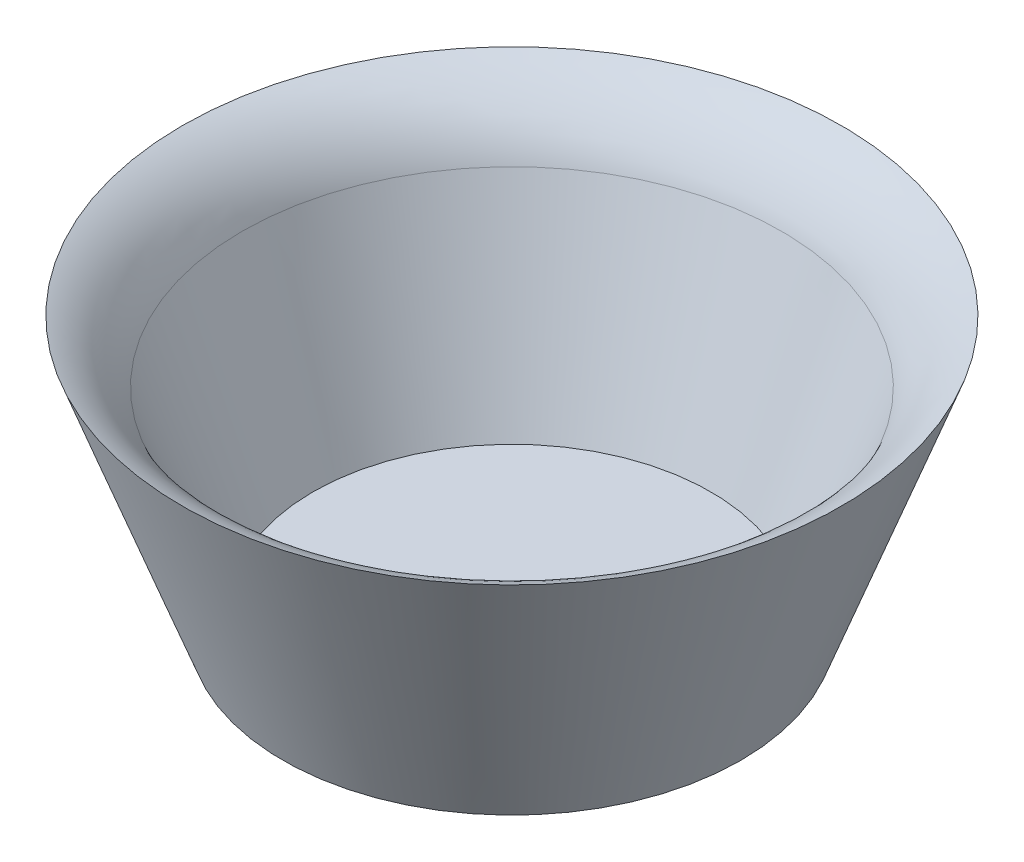
from build123d import *

# Parameters (mm, degrees)
FILLET1_R = 20


with BuildPart() as part:
    # Sketch1 → Revolve1 (revolve)
    with BuildSketch(Plane.XY):
        Polygon((0, 0), (0, -3.5), (-43, -3.5), (-61.8972698, 47.3), (-54.962104359, 47.3), (-37.36681181, 0), align=None)
    revolve(axis=Axis((0, 4.969881122, 0), (0, -1, 0)))

    # Fillet1
    # the kernel refuses this fillet: 20 mm, written as the material it takes off along each edge
    with BuildSketch(Plane(origin=(0, 47.3, 0), x_dir=(-1, 0, 0), z_dir=(0, 0, 1))) as fillet1_piece_1:
        with BuildLine():
            CenterArc((69.405347087, 18.537226746), FILLET1_R, 200.40487389, 47.545849796)
            Line((50.660300393, 11.56419122), (50.285399459, 11.424730509))
            Line((50.285399459, 11.424730509), (54.587203426, -0.139460711))
            Line((54.587203426, -0.139460711), (54.962104359, -0.4))
            ThreePointArc((54.962104359, -0.4), (58.42968708, -0.4), (61.747108254, -0.370744535))
            Line((61.747108254, -0.370744535), (61.8972698, 0))
        make_face()
    revolve(axis=Axis((0, 47.3, 0), (0, -1, 0)), mode=Mode.SUBTRACT)


solid = part.part
